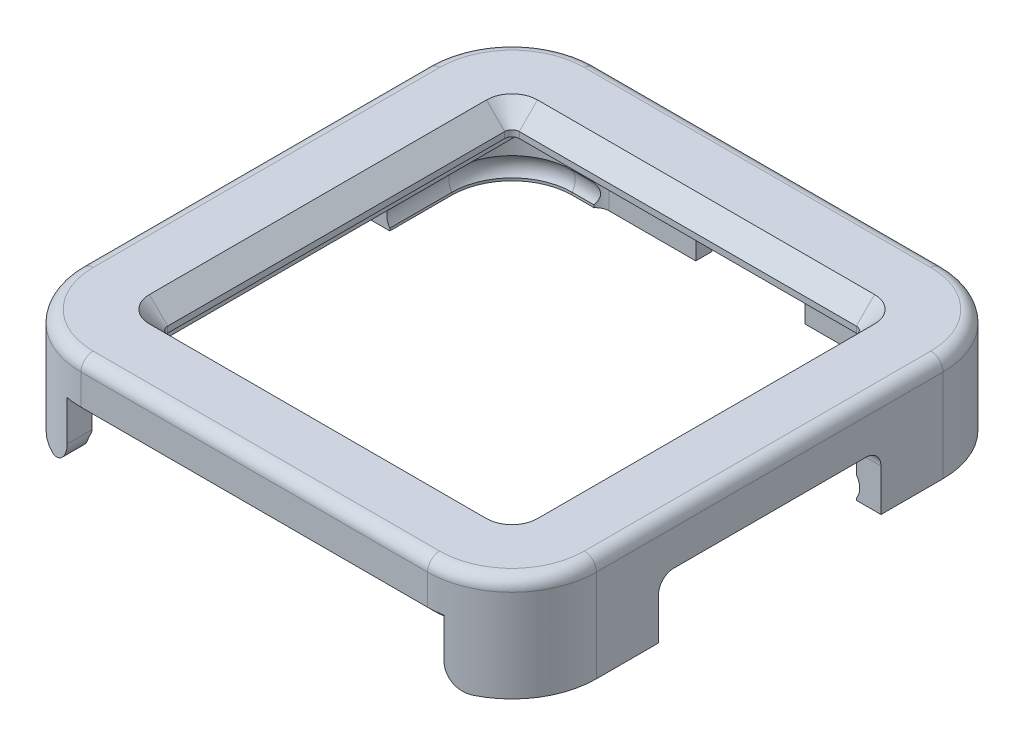
from build123d import *

# Parameters (mm, degrees)
SKETCH_1_W               = 21.2
SKETCH_1_H               = 42.4
EXTRUDE_1_DEPTH          = 8.6
SKETCH_4_W               = 19.2
SKETCH_4_H               = 38.4
CUT_EXTRUDE_1_DEPTH      = 6.6
CUT_EXTRUDE_2_DEPTH      = 49.178418405
CUT_EXTRUDE_2_DEPTH_BACK = 49.178418405
SKETCH_5_W               = 14.46
SKETCH_5_H               = 28.92
FILLET_1_R               = 0.6
CHAMFER_1_SIZE           = 1.5
FILLET_2_R               = 4.95
CUT_EXTRUDE_3_DEPTH      = 49.178418405
CUT_EXTRUDE_4_DEPTH      = 10
SKETCH_10_W              = 18.3
SKETCH_10_H              = 4.7
CUT_EXTRUDE_5_DEPTH      = 10
FILLET_3_R               = 1
SKETCH_12_W              = 31
SKETCH_12_H              = 7
CUT_EXTRUDE_6_DEPTH      = 4.4
FILLET_4_R               = 1.25
CUT_EXTRUDE_7_DEPTH      = 1
CUT_EXTRUDE_7_DEPTH_BACK = 1
SKETCH_13_W              = 1
SKETCH_13_H              = 17.8
FILLET_5_R               = 1
EXTRUDE_2_DEPTH          = 2.2
FILLET_6_R               = 1.8
CUT_EXTRUDE_8_DEPTH      = 1.3
SKETCH_16_R              = 1
CUT_EXTRUDE_9_DEPTH      = 2.2
CUT_EXTRUDE_START        = -6.6
SKETCH_17_W              = 12.7072
SKETCH_17_H              = 0.4
CUT_EXTRUDE_10_DEPTH     = 6.6
FILLET_START             = -8.6
FILLET_7_DEPTH           = 7.6
FILLET_START_2           = -4.2
FILLET_7_2_DEPTH         = 3.2
FILLET_8_R               = 1
CHAMFER_4_SIZE           = 0.25
CUT_EXTRUDE_11_DEPTH     = 0.2
CHAMFER_3_SIZE           = 0.5
CHAMFER_2_SIZE           = 0.15


with BuildPart() as part:
    # 草图1 → 凸台-拉伸1 (new body)
    with BuildSketch(Plane(origin=(0, 0, 0), x_dir=(1, 0, 0), z_dir=(0, 1, 0))):
        with Locations((10.6, -21.2)):
            Rectangle(SKETCH_1_W, SKETCH_1_H)
    extrude(amount=-EXTRUDE_1_DEPTH)

    # 草图4 → 切除-拉伸1 (cut)
    with BuildSketch(Plane.XZ.offset(8.6)):
        with Locations((9.6, 21.2)):
            Rectangle(SKETCH_4_W, SKETCH_4_H)
    extrude(amount=-CUT_EXTRUDE_1_DEPTH, mode=Mode.SUBTRACT)

    # 草图5 → 切除-拉伸2 (cut, two sides: drawn at the far end of the back side and taken through both)
    with BuildSketch(Plane(origin=(0, 0, 0), x_dir=(1, 0, 0), z_dir=(0, 1, 0)).offset(-CUT_EXTRUDE_2_DEPTH_BACK)):
        with Locations((7.23, -21.2)):
            Rectangle(SKETCH_5_W, SKETCH_5_H)
    extrude(amount=CUT_EXTRUDE_2_DEPTH + CUT_EXTRUDE_2_DEPTH_BACK, mode=Mode.SUBTRACT)

    # 圆角1
    fillet_1_edges = [part.edges().sort_by_distance(p)[0] for p in [
        (14.46, -1, 6.74),
        (14.46, -1, 35.66),
    ]]
    fillet(fillet_1_edges, radius=FILLET_1_R)

    # 倒角1
    chamfer_1_edges = [part.edges().sort_by_distance(p)[0] for p in [
        (6.93, 0, 6.74),
        (6.93, 0, 35.66),
        (14.46, 0, 21.2),
        (14.284264069, 0, 35.484264069),
        (14.284264069, 0, 6.915735931),
    ]]
    chamfer(chamfer_1_edges, length=CHAMFER_1_SIZE)

    # 圆角2
    fillet_2_edges = [part.edges().sort_by_distance(p)[0] for p in [
        (19.2, -5.3, 2),
        (19.2, -5.3, 40.4),
    ]]
    fillet(fillet_2_edges, radius=FILLET_2_R)

    # 草图7 → 切除-拉伸3 (cut, through all)
    with BuildSketch(Plane.XZ.offset(8.6)):
        with BuildLine():
            Line((0, 0), (0, -3.855300522))
            Line((0, -3.855300522), (25.103686386, -3.855300522))
            Line((25.103686386, -3.855300522), (25.103686386, 47.054511958))
            Line((25.103686386, 47.054511958), (0, 47.054511958))
            Line((0, 47.054511958), (0, 42.4))
            Line((0, 42.4), (14.25, 42.4))
            ThreePointArc((14.25, 42.4), (19.164392129, 40.364392129), (21.2, 35.45))
            Line((21.2, 35.45), (21.2, 6.95))
            ThreePointArc((21.2, 6.95), (19.164392129, 2.035607871), (14.25, 0))
            Line((14.25, 0), (0, 0))
        make_face()
    extrude(amount=-CUT_EXTRUDE_3_DEPTH, mode=Mode.SUBTRACT)

    # 草图8 → 切除-拉伸4 (cut)
    with BuildSketch(Plane(origin=(0, 0, 0), x_dir=(-1, 0, 0), z_dir=(0, 0, -1))):
        with BuildLine():
            Line((4.465093263, -9.725064822), (-4.484906737, -9.725064822))
            Line((-4.484906737, -9.725064822), (-4.484906737, -6.649433853))
            add(Edge.make_bspline(
                [(-3.234906737, -5.399433853), (-3.967139784, -5.399433853), (-4.484906737, -5.917200806), (-4.484906737, -6.649433853)],
                knots=[0, 0, 0, 0, 1, 1, 1, 1], degree=3, weights=[1, 0.804737854, 0.804737854, 1]))
            Line((-3.234906737, -5.399433853), (3.215093263, -5.399433853))
            add(Edge.make_bspline(
                [(4.465093263, -6.649433853), (4.465093263, -5.917200806), (3.94732631, -5.399433853), (3.215093263, -5.399433853)],
                knots=[0, 0, 0, 0, 1, 1, 1, 1], degree=3, weights=[1, 0.804737854, 0.804737854, 1]))
            Line((4.465093263, -6.649433853), (4.465093263, -9.725064822))
        make_face()
    extrude(amount=-CUT_EXTRUDE_4_DEPTH, mode=Mode.SUBTRACT)

    # 草图10 → 切除-拉伸5 (cut)
    with BuildSketch(Plane.ZY.offset(-19.2)):
        with Locations((21.2, -6.25)):
            Rectangle(SKETCH_10_W, SKETCH_10_H)
    extrude(amount=-CUT_EXTRUDE_5_DEPTH, mode=Mode.SUBTRACT)

    # 圆角3
    fillet_3_edges = [part.edges().sort_by_distance(p)[0] for p in [
        (19.164392129, 0, 2.035607871),
        (19.164392129, 0, 40.364392129),
        (7.125, 0, 42.4),
        (21.2, 0, 21.2),
        (7.125, 0, 0),
    ]]
    fillet(fillet_3_edges, radius=FILLET_3_R)

    # 草图12 → 切除-拉伸6 (cut)
    with BuildSketch(Plane.XZ.offset(8.6)):
        with Locations((0, 41.376503543)):
            Rectangle(SKETCH_12_W, SKETCH_12_H)
    extrude(amount=-CUT_EXTRUDE_6_DEPTH, mode=Mode.SUBTRACT)

    # 圆角4
    fillet_4_edges = [part.edges().sort_by_distance(p)[0] for p in [
        (20.2, -3.9, 30.35),
        (20.2, -3.9, 12.05),
    ]]
    fillet(fillet_4_edges, radius=FILLET_4_R)

    # 草图13 → 切除-拉伸7 (cut, two sides: drawn at the far end of the back side and taken through both)
    with BuildSketch(Plane.XZ.offset(3.9).offset(-CUT_EXTRUDE_7_DEPTH_BACK)):
        with Locations((19.7, 21.2)):
            Rectangle(SKETCH_13_W, SKETCH_13_H)
    extrude(amount=CUT_EXTRUDE_7_DEPTH + CUT_EXTRUDE_7_DEPTH_BACK, mode=Mode.SUBTRACT)

    # 圆角5
    fillet_5_edges = [part.edges().sort_by_distance(p)[0] for p in [
        (20.2, -3.65, 30.1),
        (20.2, -3.65, 12.3),
    ]]
    fillet(fillet_5_edges, radius=FILLET_5_R - 0.0001)  # a hair under: the kernel refuses the full size

    # 草图14 → 凸台-拉伸2 (add)
    with BuildSketch(Plane.XZ.offset(2)):
        with BuildLine():
            Line((16.0072, 36.81), (0, 36.81))
            Line((0, 36.81), (0, 40.4))
            Line((0, 40.4), (14.25, 40.4))
            ThreePointArc((14.25, 40.4), (17.750178567, 38.950178567), (19.2, 35.45))
            Line((19.2, 35.45), (19.2, 6.95))
            ThreePointArc((19.2, 6.95), (17.750178567, 3.449821433), (14.25, 2))
            Line((14.25, 2), (12.7072, 2))
            Line((12.7072, 2), (12.7072, 2.6312))
            Line((12.7072, 2.6312), (16.0072, 2.6312))
            Line((16.0072, 2.6312), (16.0072, 36.81))
        make_face()
    extrude(amount=EXTRUDE_2_DEPTH)

    # 圆角6
    fillet_6_edges = [part.edges().sort_by_distance(p)[0] for p in [
        (15.5, -8.6, 41.26311893),
    ]]
    fillet(fillet_6_edges, radius=FILLET_6_R)

    # 草图15 → 切除-拉伸8 (cut)
    with BuildSketch(Plane.XZ.offset(4.2)):
        with BuildLine():
            Line((18.2, 29.1), (18.2, 13.3))
            ThreePointArc((18.2, 13.3), (18.492893219, 12.592893219), (19.2, 12.3))
            Line((19.2, 12.3), (19.2, 30.1))
            ThreePointArc((19.2, 30.1), (18.492893219, 29.807106781), (18.2, 29.1))
        make_face()
    extrude(amount=-CUT_EXTRUDE_8_DEPTH, mode=Mode.SUBTRACT)

    # 草图16 → 切除-拉伸9 (cut)
    with BuildSketch(Plane.XZ.offset(4.2)):
        with Locations((15.300093219, 36.102893219)):
            Circle(SKETCH_16_R)
        with Locations((15.300093219, 3.338306781)):
            Circle(SKETCH_16_R)
    extrude(amount=-CUT_EXTRUDE_9_DEPTH, mode=Mode.SUBTRACT)

    # 草图17 → 切除-拉伸10 (cut)
    with BuildSketch(Plane.XZ.offset(8.6).offset(CUT_EXTRUDE_START)):
        with Locations((6.3536, 1.8)):
            Rectangle(SKETCH_17_W, SKETCH_17_H)
    extrude(amount=CUT_EXTRUDE_10_DEPTH, mode=Mode.SUBTRACT)

    # 圆角7: read off the stored shape, not the designer's step
    # 圆角7 outline → 圆角7 (add)
    with BuildSketch(Plane(origin=(0, 0, 0), x_dir=(1, 0, 0), z_dir=(0, 1, 0)).offset(FILLET_START)):
        with BuildLine():
            Line((12.457881809, -2), (12.7072, -2))
            Line((12.7072, -2), (12.7072, -1.6))
            Line((12.7072, -1.6), (11.609353672, -1.6))
            ThreePointArc((11.609353672, -1.6), (12.078395248, -1.705012563), (12.457881809, -2))
        make_face()
    extrude(amount=FILLET_7_DEPTH)

    # Fillet 7 2 outline → Fillet 7 2 (add)
    with BuildSketch(Plane(origin=(0, 0, 0), x_dir=(1, 0, 0), z_dir=(0, 1, 0)).offset(FILLET_START_2)):
        with BuildLine():
            Line((12.7072, -2.6312), (12.7072, -2))
            Line((12.7072, -2), (12.457881809, -2))
            ThreePointArc((12.457881809, -2), (12.632435658, -2.295892032), (12.7072, -2.6312))
        make_face()
    extrude(amount=FILLET_7_2_DEPTH)

    # 圆角8
    fillet_8_edges = [part.edges().sort_by_distance(p)[0] for p in [
        (12.7072, -3.1, 2.6312),
        (14.592986438, -3.1, 2.6312),
        (16.0072, -3.1, 35.395786438),
        (14.592986438, -3.1, 36.81),
        (16.0072, -3.1, 4.045413562),
    ]]
    fillet(fillet_8_edges, radius=FILLET_8_R)

    # 倒角4
    chamfer_4_edges = [part.edges().sort_by_distance(p)[0] for p in [
        (1.617453369, -5.399433853, 0),
        (4.118790214, -5.765550377, 0),
        (4.484906737, -7.624716926, 0),
    ]]
    chamfer(chamfer_4_edges, length=CHAMFER_4_SIZE)

    # 切除-扫描1: sweep along a path in 草图18
    with BuildLine(Plane(origin=(0, -7.6, 0), x_dir=(-1, 0, 0), z_dir=(0, -1, 0))) as sweep_1_path:
        Line((0, -2), (-14.25, -2))
        ThreePointArc((-14.25, -2), (-17.750178567, -3.449821433), (-19.2, -6.95))
        Line((-19.2, -6.95), (-19.2, -35.45))
        ThreePointArc((-19.2, -35.45), (-18.167269457, -38.47613615), (-15.5, -40.239572006))
    # 草图19 → 切除-扫描1 (sweep, cut)
    with BuildSketch(Plane(origin=(0, 0, 0), x_dir=(0, 0, -1), z_dir=(1, 0, 0))):
        with BuildLine():
            Line((-2, -8.392148976), (-2, -6.807851024))
            ThreePointArc((-2, -6.807851024), (-1.75, -7.6), (-2, -8.392148976))
        make_face()
    sweep(path=sweep_1_path.line, mode=Mode.SUBTRACT)

    # 草图20 → 切除-拉伸11 (cut)
    with BuildSketch(Plane.XZ.offset(4.2)):
        with BuildLine():
            Line((14.258082452, 2.6312), (13.417022491, 2.6312))
            ThreePointArc((13.417022491, 2.6312), (12.921518899, 2.499805889), (12.556227815, 2.140152381))
            ThreePointArc((12.556227815, 2.140152381), (12.509785796, 2.068159838), (12.457881809, 2))
            Line((12.457881809, 2), (14.25, 2))
            ThreePointArc((14.25, 2), (17.750178567, 3.449821433), (19.2, 6.95))
            Line((19.2, 6.95), (19.2, 12.3))
            ThreePointArc((19.2, 12.3), (18.492893219, 12.592893219), (18.2, 13.3))
            Line((18.2, 13.3), (18.2, 29.1))
            ThreePointArc((18.2, 29.1), (18.492893219, 29.807106781), (19.2, 30.1))
            Line((19.2, 30.1), (19.2, 35.45))
            ThreePointArc((19.2, 35.45), (18.167269457, 38.47613615), (15.5, 40.239572006))
            Line((15.5, 40.239572006), (15.5, 42.286665854))
            ThreePointArc((15.5, 42.286665854), (14.877563668, 42.371608472), (14.25, 42.4))
            Line((14.25, 42.4), (0, 42.4))
            Line((0, 42.4), (0, 36.81))
            Line((0, 36.81), (14.258082452, 36.81))
            ThreePointArc((14.258082452, 36.81), (14.528680502, 36.84730758), (14.779087836, 36.956446609))
            ThreePointArc((14.779087836, 36.956446609), (16.0072, 36.81), (16.153646609, 35.581887836))
            ThreePointArc((16.153646609, 35.581887836), (16.04450758, 35.331480502), (16.0072, 35.060882452))
            Line((16.0072, 35.060882452), (16.0072, 4.380317548))
            ThreePointArc((16.0072, 4.380317548), (16.04450758, 4.109719498), (16.153646609, 3.859312164))
            ThreePointArc((16.153646609, 3.859312164), (16.0072, 2.6312), (14.779087836, 2.484753391))
            ThreePointArc((14.779087836, 2.484753391), (14.528680502, 2.59389242), (14.258082452, 2.6312))
        make_face()
    extrude(amount=-CUT_EXTRUDE_11_DEPTH, mode=Mode.SUBTRACT)

    # 倒角3
    chamfer_3_edges = [part.edges().sort_by_distance(p)[0] for p in [
        (7.125, -4, 42.4),
        (14.877563668, -4, 42.371608472),
    ]]
    chamfer(chamfer_3_edges, length=CHAMFER_3_SIZE)

    # 倒角2
    # the kernel refuses this chamfer: 0.15 mm, written as the material it takes off along each edge
    with BuildSketch(Plane(origin=(14.258082452, -4, 1.6312), x_dir=(0.5210053832799826, 0, 0.8535533905932767), z_dir=(0.8535533905932767, 0, -0.5210053832799826))) as chamfer_2_piece_1:
        Polygon((1 - CHAMFER_2_SIZE, 0), (1, -CHAMFER_2_SIZE), (1, 0), align=None)
    revolve(axis=Axis((14.258082452, -4, 1.6312), (0, -1, 0)), revolution_arc=31.39971481, mode=Mode.SUBTRACT)
    with BuildSketch(Plane(origin=(15.300093219, -4, 3.338306781), x_dir=(0.8535533905932791, 0, 0.5210053832799784), z_dir=(-0.5210053832799784, 0, 0.8535533905932791))) as chamfer_2_piece_2:
        Polygon((1 + CHAMFER_2_SIZE, 0), (1, CHAMFER_2_SIZE), (1, 0), align=None)
    revolve(axis=Axis((15.300093219, -4, 3.338306781), (0, 1, 0)), revolution_arc=152.79942962, mode=Mode.SUBTRACT)
    with BuildSketch(Plane(origin=(17.0072, -4, 4.380317548), x_dir=(-1, 0, 0), z_dir=(0, 0, 1))) as chamfer_2_piece_3:
        Polygon((1 - CHAMFER_2_SIZE, 0), (1, -CHAMFER_2_SIZE), (1, 0), align=None)
    revolve(axis=Axis((17.0072, -4, 4.380317548), (0, -1, 0)), revolution_arc=31.39971481, mode=Mode.SUBTRACT)
    with BuildSketch(Plane(origin=(16.0072, -4, 35.060882452), x_dir=(1, 0, 0), z_dir=(0, 0, -1))) as chamfer_2_piece_4:
        Polygon((CHAMFER_2_SIZE, 0), (0, -CHAMFER_2_SIZE), (0, 0), align=None)
    extrude(amount=30.680564905, mode=Mode.SUBTRACT)
    with BuildSketch(Plane(origin=(17.0072, -4, 35.060882452), x_dir=(-0.8535533905933052, 0, 0.5210053832799358), z_dir=(0.5210053832799358, 0, 0.8535533905933052))) as chamfer_2_piece_5:
        Polygon((1 - CHAMFER_2_SIZE, 0), (1, -CHAMFER_2_SIZE), (1, 0), align=None)
    revolve(axis=Axis((17.0072, -4, 35.060882452), (0, -1, 0)), revolution_arc=31.39971481, mode=Mode.SUBTRACT)
    with BuildSketch(Plane(origin=(15.300093219, -4, 36.102893219), x_dir=(-0.5210053832799266, 0, 0.8535533905933107), z_dir=(-0.8535533905933107, 0, -0.5210053832799266))) as chamfer_2_piece_6:
        Polygon((1 + CHAMFER_2_SIZE, 0), (1, CHAMFER_2_SIZE), (1, 0), align=None)
    revolve(axis=Axis((15.300093219, -4, 36.102893219), (0, 1, 0)), revolution_arc=152.79942962, mode=Mode.SUBTRACT)
    with BuildSketch(Plane(origin=(14.258082452, -4, 37.81), x_dir=(0, 0, -1), z_dir=(-1, 0, 0))) as chamfer_2_piece_7:
        Polygon((1 - CHAMFER_2_SIZE, 0), (1, -CHAMFER_2_SIZE), (1, 0), align=None)
    revolve(axis=Axis((14.258082452, -4, 37.81), (0, -1, 0)), revolution_arc=31.39971481, mode=Mode.SUBTRACT)
    with BuildSketch(Plane(origin=(-0.385752448, -4, 36.81), x_dir=(0, 0, 1), z_dir=(1, 0, 0))) as chamfer_2_piece_8:
        Polygon((CHAMFER_2_SIZE, 0), (0, -CHAMFER_2_SIZE), (0, 0), align=None)
    extrude(amount=14.6438349, mode=Mode.SUBTRACT)
    with BuildSketch(Plane(origin=(11.609353672, -4, 2.7), x_dir=(0.8607946758293324, 0, -0.5089523809393904), z_dir=(0.5089523809393904, 0, 0.8607946758293324))) as chamfer_2_piece_9_section:
        Polygon((1.1 + CHAMFER_2_SIZE, 0), (1.1 - CHAMFER_2_SIZE * 1.33705639153e-09, CHAMFER_2_SIZE), (1.1, 0), align=None)
    chamfer_2_piece_9 = revolve(axis=Axis((11.609353672, -4, 2.7), (0, 1, 0)), revolution_arc=29.019917876, mode=Mode.PRIVATE)
    chamfer_2_piece_9 = split(chamfer_2_piece_9, bisect_by=Plane(origin=(11.609353672, -4, 2), z_dir=(0, 0, 1)), keep=Keep.TOP, mode=Mode.PRIVATE)
    add(chamfer_2_piece_9, mode=Mode.SUBTRACT)
    with BuildSketch(Plane(origin=(13.417022491, -4, 1.6312), x_dir=(0, 0, 1), z_dir=(1, 0, 0))) as chamfer_2_piece_10:
        Polygon((1 - CHAMFER_2_SIZE, 0), (1, -CHAMFER_2_SIZE), (1, 0), align=None)
    revolve(axis=Axis((13.417022491, -4, 1.6312), (0, -1, 0)), revolution_arc=59.40592647, mode=Mode.SUBTRACT)
    with BuildSketch(Plane(origin=(14.258082452, -4, 2.6312), x_dir=(0, 0, -1), z_dir=(-1, 0, 0))) as chamfer_2_piece_11:
        Polygon((CHAMFER_2_SIZE, 0), (0, -CHAMFER_2_SIZE), (0, 0), align=None)
    extrude(amount=0.841059961, mode=Mode.SUBTRACT)

    # 镜向1: part across plane


with BuildPart() as part_1:
    add(part.part)
    add(part.part.mirror(Plane(origin=(0, 0, 0), x_dir=(0, 0, 1), z_dir=(1, 0, 0))))


solid = part_1.part
